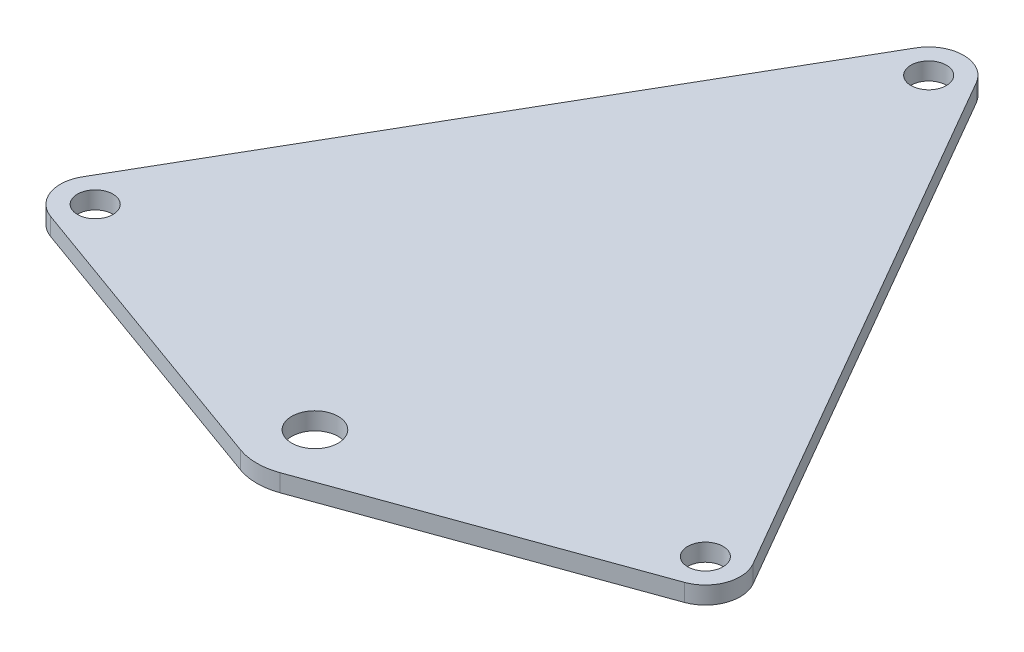
from build123d import *

# Parameters (mm, degrees)
SKETCH1_R           = 3.05
SKETCH1_R_2         = 4
BOSS_EXTRUDE1_DEPTH = 3


with BuildPart() as part:
    # Sketch1 → Boss-Extrude1 (new body)
    with BuildSketch(Plane(origin=(0, 0, 0), x_dir=(1, 0, 0), z_dir=(0, 1, 0))):
        with BuildLine():
            ThreePointArc((5.196152423, 63.621778265), (0, 66.621778265), (-5.196152423, 63.621778265))
            Line((-5.196152423, 63.621778265), (-57.696152423, -27.310889132))
            ThreePointArc((-57.696152423, -27.310889132), (-58.135266046, -32.370931995), (-54.536264711, -35.9547908))
            Line((-54.536264711, -35.9547908), (-3.393774518, -54.406502778))
            ThreePointArc((-3.393774518, -54.406502778), (0, -55), (3.393774518, -54.406502778))
            Line((3.393774518, -54.406502778), (54.536264711, -35.9547908))
            ThreePointArc((54.536264711, -35.9547908), (58.135266046, -32.370931995), (57.696152423, -27.310889132))
            Line((57.696152423, -27.310889132), (5.196152423, 63.621778265))
        make_face()
        with Locations((-52.5, -30.310889132)):
            Circle(SKETCH1_R, mode=Mode.SUBTRACT)
        with Locations((52.5, -30.310889132)):
            Circle(SKETCH1_R, mode=Mode.SUBTRACT)
        with Locations((0, 60.621778265)):
            Circle(SKETCH1_R, mode=Mode.SUBTRACT)
        with Locations((0, -45)):
            Circle(SKETCH1_R_2, mode=Mode.SUBTRACT)
    extrude(amount=BOSS_EXTRUDE1_DEPTH)


solid = part.part
